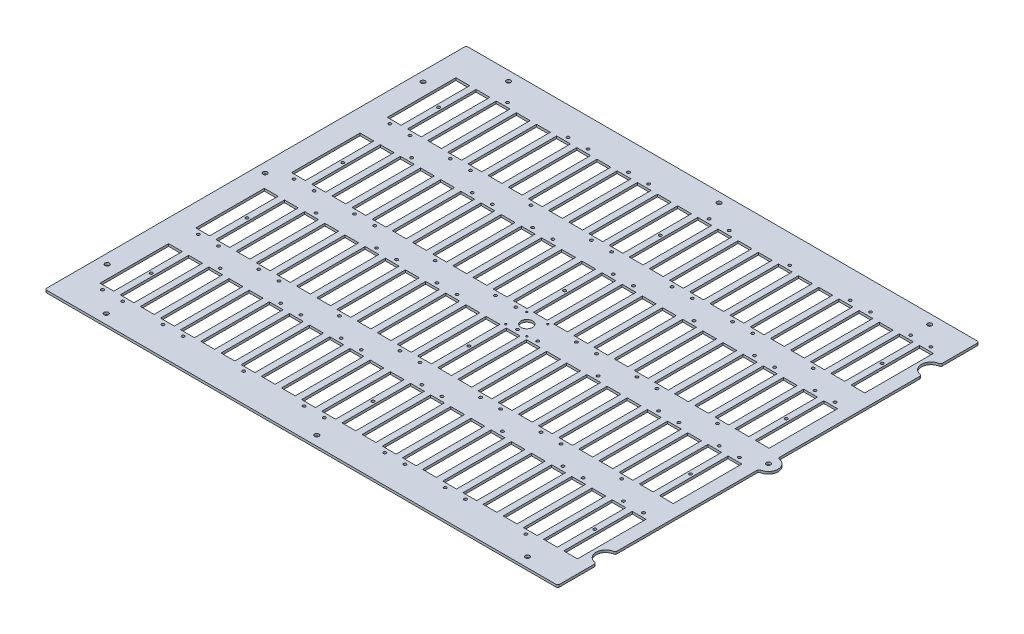
from build123d import *

# Parameters (mm, degrees)
BOSS_EXTRUDE1_DEPTH          = 3.175
SKETCH17_W                   = 18.288
SKETCH17_H                   = 90.932
CUT_EXTRUDE5_DEPTH           = 451.265762746
F_25_0_1495_DIAMETER_HOLE1_D = 3.7973
FILLET1_R                    = 2.54
F_6_CLEARANCE_HOLE1_D        = 3.7973
F_2_CLEARANCE_HOLE1_D        = 2.4384
SKETCH20_R                   = 7.62
CUT_EXTRUDE6_DEPTH           = 451.265762746
F_1_0_228_DIAMETER_HOLE1_D   = 5.7912


with BuildPart() as part:
    # Sketch1 → Boss-Extrude1 (new body)
    with BuildSketch(Plane(origin=(0, 0, 0), x_dir=(1, 0, 0), z_dir=(0, 1, 0))):
        with BuildLine():
            Line((340.2584, 228.6), (340.2584, 279.5524))
            Line((340.2584, 279.5524), (-340.2584, 279.5524))
            Line((-340.2584, 279.5524), (-340.2584, -279.5524))
            Line((-340.2584, -279.5524), (340.2584, -279.5524))
            Line((340.2584, -279.5524), (340.2584, -228.6))
            ThreePointArc((340.2584, -228.6), (327.5584, -215.9), (340.2584, -203.2))
            Line((340.2584, -203.2), (340.2584, -12.7))
            ThreePointArc((340.2584, -12.7), (352.9584, 0), (340.2584, 12.7))
            Line((340.2584, 12.7), (340.2584, 203.2))
            ThreePointArc((340.2584, 203.2), (327.5584, 215.9), (340.2584, 228.6))
        make_face()
    extrude(amount=BOSS_EXTRUDE1_DEPTH)

    # Sketch17 → Cut-Extrude5 (cut, through all)
    with BuildSketch(Plane(origin=(0, 3.175, 0), x_dir=(1, 0, 0), z_dir=(0, 1, 0))):
        with Locations((-274.696582609, 190.6524)):
            Rectangle(SKETCH17_W, SKETCH17_H)
        with Locations((-301.4472, 190.6524)):
            Rectangle(SKETCH17_W, SKETCH17_H)
        with Locations((-247.945965217, 190.6524)):
            Rectangle(SKETCH17_W, SKETCH17_H)
        with Locations((-221.195347826, 190.6524)):
            Rectangle(SKETCH17_W, SKETCH17_H)
        with Locations((-194.444730435, 190.6524)):
            Rectangle(SKETCH17_W, SKETCH17_H)
        with Locations((-167.694113043, 190.6524)):
            Rectangle(SKETCH17_W, SKETCH17_H)
        with Locations((-140.943495652, 190.6524)):
            Rectangle(SKETCH17_W, SKETCH17_H)
        with Locations((-114.192878261, 190.6524)):
            Rectangle(SKETCH17_W, SKETCH17_H)
        with Locations((-87.44226087, 190.6524)):
            Rectangle(SKETCH17_W, SKETCH17_H)
        with Locations((-60.691643478, 190.6524)):
            Rectangle(SKETCH17_W, SKETCH17_H)
        with Locations((-33.941026087, 190.6524)):
            Rectangle(SKETCH17_W, SKETCH17_H)
        with Locations((-7.190408696, 190.6524)):
            Rectangle(SKETCH17_W, SKETCH17_H)
        with Locations((19.560208696, 190.6524)):
            Rectangle(SKETCH17_W, SKETCH17_H)
        with Locations((46.310826087, 190.6524)):
            Rectangle(SKETCH17_W, SKETCH17_H)
        with Locations((73.061443478, 190.6524)):
            Rectangle(SKETCH17_W, SKETCH17_H)
        with Locations((99.81206087, 190.6524)):
            Rectangle(SKETCH17_W, SKETCH17_H)
        with Locations((126.562678261, 190.6524)):
            Rectangle(SKETCH17_W, SKETCH17_H)
        with Locations((153.313295652, 190.6524)):
            Rectangle(SKETCH17_W, SKETCH17_H)
        with Locations((180.063913043, 190.6524)):
            Rectangle(SKETCH17_W, SKETCH17_H)
        with Locations((206.814530435, 190.6524)):
            Rectangle(SKETCH17_W, SKETCH17_H)
        with Locations((233.565147826, 190.6524)):
            Rectangle(SKETCH17_W, SKETCH17_H)
        with Locations((260.315765217, 190.6524)):
            Rectangle(SKETCH17_W, SKETCH17_H)
        with Locations((287.066382609, 190.6524)):
            Rectangle(SKETCH17_W, SKETCH17_H)
        with Locations((313.817, 190.6524)):
            Rectangle(SKETCH17_W, SKETCH17_H)
        with Locations((-274.696582609, 63.5762)):
            Rectangle(SKETCH17_W, SKETCH17_H)
        with Locations((-247.945965217, 63.5762)):
            Rectangle(SKETCH17_W, SKETCH17_H)
        with Locations((-221.195347826, 63.5762)):
            Rectangle(SKETCH17_W, SKETCH17_H)
        with Locations((-194.444730435, 63.5762)):
            Rectangle(SKETCH17_W, SKETCH17_H)
        with Locations((-167.694113043, 63.5762)):
            Rectangle(SKETCH17_W, SKETCH17_H)
        with Locations((-140.943495652, 63.5762)):
            Rectangle(SKETCH17_W, SKETCH17_H)
        with Locations((-114.192878261, 63.5762)):
            Rectangle(SKETCH17_W, SKETCH17_H)
        with Locations((-87.44226087, 63.5762)):
            Rectangle(SKETCH17_W, SKETCH17_H)
        with Locations((-60.691643478, 63.5762)):
            Rectangle(SKETCH17_W, SKETCH17_H)
        with Locations((-33.941026087, 63.5762)):
            Rectangle(SKETCH17_W, SKETCH17_H)
        with Locations((-7.190408696, 63.5762)):
            Rectangle(SKETCH17_W, SKETCH17_H)
        with Locations((19.560208696, 63.5762)):
            Rectangle(SKETCH17_W, SKETCH17_H)
        with Locations((46.310826087, 63.5762)):
            Rectangle(SKETCH17_W, SKETCH17_H)
        with Locations((73.061443478, 63.5762)):
            Rectangle(SKETCH17_W, SKETCH17_H)
        with Locations((99.81206087, 63.5762)):
            Rectangle(SKETCH17_W, SKETCH17_H)
        with Locations((126.562678261, 63.5762)):
            Rectangle(SKETCH17_W, SKETCH17_H)
        with Locations((153.313295652, 63.5762)):
            Rectangle(SKETCH17_W, SKETCH17_H)
        with Locations((180.063913043, 63.5762)):
            Rectangle(SKETCH17_W, SKETCH17_H)
        with Locations((206.814530435, 63.5762)):
            Rectangle(SKETCH17_W, SKETCH17_H)
        with Locations((233.565147826, 63.5762)):
            Rectangle(SKETCH17_W, SKETCH17_H)
        with Locations((260.315765217, 63.5762)):
            Rectangle(SKETCH17_W, SKETCH17_H)
        with Locations((287.066382609, 63.5762)):
            Rectangle(SKETCH17_W, SKETCH17_H)
        with Locations((313.817, 63.5762)):
            Rectangle(SKETCH17_W, SKETCH17_H)
        with Locations((-274.696582609, -63.5)):
            Rectangle(SKETCH17_W, SKETCH17_H)
        with Locations((-247.945965217, -63.5)):
            Rectangle(SKETCH17_W, SKETCH17_H)
        with Locations((-221.195347826, -63.5)):
            Rectangle(SKETCH17_W, SKETCH17_H)
        with Locations((-194.444730435, -63.5)):
            Rectangle(SKETCH17_W, SKETCH17_H)
        with Locations((-167.694113043, -63.5)):
            Rectangle(SKETCH17_W, SKETCH17_H)
        with Locations((-140.943495652, -63.5)):
            Rectangle(SKETCH17_W, SKETCH17_H)
        with Locations((-114.192878261, -63.5)):
            Rectangle(SKETCH17_W, SKETCH17_H)
        with Locations((-87.44226087, -63.5)):
            Rectangle(SKETCH17_W, SKETCH17_H)
        with Locations((-60.691643478, -63.5)):
            Rectangle(SKETCH17_W, SKETCH17_H)
        with Locations((-33.941026087, -63.5)):
            Rectangle(SKETCH17_W, SKETCH17_H)
        with Locations((-7.190408696, -63.5)):
            Rectangle(SKETCH17_W, SKETCH17_H)
        with Locations((19.560208696, -63.5)):
            Rectangle(SKETCH17_W, SKETCH17_H)
        with Locations((46.310826087, -63.5)):
            Rectangle(SKETCH17_W, SKETCH17_H)
        with Locations((73.061443478, -63.5)):
            Rectangle(SKETCH17_W, SKETCH17_H)
        with Locations((99.81206087, -63.5)):
            Rectangle(SKETCH17_W, SKETCH17_H)
        with Locations((126.562678261, -63.5)):
            Rectangle(SKETCH17_W, SKETCH17_H)
        with Locations((153.313295652, -63.5)):
            Rectangle(SKETCH17_W, SKETCH17_H)
        with Locations((180.063913043, -63.5)):
            Rectangle(SKETCH17_W, SKETCH17_H)
        with Locations((206.814530435, -63.5)):
            Rectangle(SKETCH17_W, SKETCH17_H)
        with Locations((233.565147826, -63.5)):
            Rectangle(SKETCH17_W, SKETCH17_H)
        with Locations((260.315765217, -63.5)):
            Rectangle(SKETCH17_W, SKETCH17_H)
        with Locations((287.066382609, -63.5)):
            Rectangle(SKETCH17_W, SKETCH17_H)
        with Locations((313.817, -63.5)):
            Rectangle(SKETCH17_W, SKETCH17_H)
        with Locations((-274.696582609, -190.5762)):
            Rectangle(SKETCH17_W, SKETCH17_H)
        with Locations((-247.945965217, -190.5762)):
            Rectangle(SKETCH17_W, SKETCH17_H)
        with Locations((-221.195347826, -190.5762)):
            Rectangle(SKETCH17_W, SKETCH17_H)
        with Locations((-194.444730435, -190.5762)):
            Rectangle(SKETCH17_W, SKETCH17_H)
        with Locations((-167.694113043, -190.5762)):
            Rectangle(SKETCH17_W, SKETCH17_H)
        with Locations((-140.943495652, -190.5762)):
            Rectangle(SKETCH17_W, SKETCH17_H)
        with Locations((-114.192878261, -190.5762)):
            Rectangle(SKETCH17_W, SKETCH17_H)
        with Locations((-87.44226087, -190.5762)):
            Rectangle(SKETCH17_W, SKETCH17_H)
        with Locations((-60.691643478, -190.5762)):
            Rectangle(SKETCH17_W, SKETCH17_H)
        with Locations((-33.941026087, -190.5762)):
            Rectangle(SKETCH17_W, SKETCH17_H)
        with Locations((-7.190408696, -190.5762)):
            Rectangle(SKETCH17_W, SKETCH17_H)
        with Locations((19.560208696, -190.5762)):
            Rectangle(SKETCH17_W, SKETCH17_H)
        with Locations((46.310826087, -190.5762)):
            Rectangle(SKETCH17_W, SKETCH17_H)
        with Locations((73.061443478, -190.5762)):
            Rectangle(SKETCH17_W, SKETCH17_H)
        with Locations((99.81206087, -190.5762)):
            Rectangle(SKETCH17_W, SKETCH17_H)
        with Locations((126.562678261, -190.5762)):
            Rectangle(SKETCH17_W, SKETCH17_H)
        with Locations((153.313295652, -190.5762)):
            Rectangle(SKETCH17_W, SKETCH17_H)
        with Locations((180.063913043, -190.5762)):
            Rectangle(SKETCH17_W, SKETCH17_H)
        with Locations((206.814530435, -190.5762)):
            Rectangle(SKETCH17_W, SKETCH17_H)
        with Locations((233.565147826, -190.5762)):
            Rectangle(SKETCH17_W, SKETCH17_H)
        with Locations((260.315765217, -190.5762)):
            Rectangle(SKETCH17_W, SKETCH17_H)
        with Locations((287.066382609, -190.5762)):
            Rectangle(SKETCH17_W, SKETCH17_H)
        with Locations((313.817, -190.5762)):
            Rectangle(SKETCH17_W, SKETCH17_H)
        with Locations((-301.4472, 63.5762)):
            Rectangle(SKETCH17_W, SKETCH17_H)
        with Locations((-301.4472, -63.5)):
            Rectangle(SKETCH17_W, SKETCH17_H)
        with Locations((-301.4472, -190.5762)):
            Rectangle(SKETCH17_W, SKETCH17_H)
    extrude(amount=-CUT_EXTRUDE5_DEPTH, mode=Mode.SUBTRACT)

    # #25 (0.1495) Diameter Hole1 (through all)
    with Locations(Plane(origin=(0, 3.175, 0), x_dir=(1, 0, 0), z_dir=(0, 1, 0))):
        with Locations((-301.447198222, 139.3444), (313.817, -139.2682), (287.066382686, -139.2682), (260.315765372, -241.8842), (233.565148058, -139.2682), (206.814530744, -139.2682), (180.06391343, -241.8842), (153.313296116, -241.8842), (126.562678802, -139.2682), (99.812061488, -241.8842), (73.061444174, -241.8842), (46.31082686, -139.2682), (19.560209546, -139.2682), (-7.190407768, -241.8842), (-33.941025082, -241.8842), (-60.691642396, -139.2682), (-87.44225971, -139.2682), (-114.192877024, -241.8842), (-140.943494338, -139.2682), (-167.694111652, -139.2682), (-194.444728966, -241.8842), (-221.19534628, -241.8842), (-247.945963594, -139.2682), (-274.696580908, -241.8842), (-301.447198222, -241.8842), (313.817, -12.192), (287.066382686, -12.192), (260.315765372, -114.808), (233.565148058, -12.192), (206.814530744, -12.192), (180.06391343, -114.808), (153.313296116, -114.808), (126.562678802, -12.192), (99.812061488, -114.808), (73.061444174, -114.808), (46.31082686, -12.192), (19.560209546, -12.192), (-7.190407768, -114.808), (-33.941025082, -114.808), (-60.691642396, -12.192), (-87.44225971, -12.192), (-114.192877024, -114.808), (-140.943494338, -12.192), (-167.694111652, -12.192), (-194.444728966, -114.808), (-221.19534628, -114.808), (-247.945963594, -12.192), (-274.696580908, -114.808), (-301.447198222, -114.808), (313.817, 114.8842), (287.066382686, 114.8842), (260.315765372, 12.2682), (233.565148058, 114.8842), (206.814530744, 114.8842), (180.06391343, 12.2682), (153.313296116, 12.2682), (126.562678802, 114.8842), (99.812061488, 12.2682), (73.061444174, 12.2682), (46.31082686, 114.8842), (19.560209546, 114.8842), (-7.190407768, 12.2682), (-33.941025082, 12.2682), (-60.691642396, 114.8842), (-87.44225971, 114.8842), (-114.192877024, 12.2682), (-140.943494338, 114.8842), (-167.694111652, 114.8842), (-194.444728966, 12.2682), (-221.19534628, 12.2682), (-247.945963594, 114.8842), (-274.696580908, 12.2682), (-301.447198222, 12.2682), (313.817, 241.9604), (287.066382686, 241.9604), (260.315765372, 139.3444), (233.565148058, 241.9604), (206.814530744, 241.9604), (180.06391343, 139.3444), (153.313296116, 139.3444), (126.562678802, 241.9604), (99.812061488, 139.3444), (73.061444174, 139.3444), (46.31082686, 241.9604), (19.560209546, 241.9604), (-7.190407768, 139.3444), (-33.941025082, 139.3444), (-60.691642396, 241.9604), (-87.44225971, 241.9604), (-114.192877024, 139.3444), (-140.943494338, 241.9604), (-167.694111652, 241.9604), (-194.444728966, 139.3444), (-221.19534628, 139.3444), (-247.945963594, 241.9604), (-274.696580908, 139.3444)):
            Hole(F_25_0_1495_DIAMETER_HOLE1_D / 2)

    # Fillet1
    fillet1_edges = [part.edges().sort_by_distance(p)[0] for p in [
        (-340.2584, 1.5875, -279.5524),
        (-340.2584, 1.5875, 279.5524),
        (340.2584, 1.5875, 279.5524),
        (340.2584, 1.5875, 228.6),
        (340.2584, 1.5875, 203.2),
        (340.2584, 1.5875, 12.7),
        (340.2584, 1.5875, -12.7),
        (340.2584, 1.5875, -203.2),
        (340.2584, 1.5875, -279.5524),
        (340.2584, 1.5875, -228.6),
    ]]
    fillet(fillet1_edges, radius=FILLET1_R)

    # #6 Clearance Hole1 (through all)
    with Locations(Plane(origin=(0, 3.175, 0), x_dir=(1, 0, 0), z_dir=(0, 1, 0))):
        with Locations((300.441691304, -190.5762), (-288.071891304, 190.6524), (6.1849, 190.6524), (300.441691304, 190.6524), (-288.071891304, 63.5762), (6.1849, 63.5762), (300.441691304, 63.5762), (-288.071891304, -63.5), (6.1849, -63.5), (300.441691304, -63.5), (-288.071891304, -190.5762), (6.1849, -190.5762)):
            Hole(F_6_CLEARANCE_HOLE1_D / 2)

    # #2 Clearance Hole1 (through all)
    with Locations(Plane(origin=(0, 3.175, 0), x_dir=(1, 0, 0), z_dir=(0, 1, 0))):
        with Locations((33.5661, 14.0081), (5.6261, 14.0081), (5.6261, -13.9319), (33.5661, -13.9319)):
            Hole(F_2_CLEARANCE_HOLE1_D / 2)

    # Sketch20 → Cut-Extrude6 (cut, through all)
    with BuildSketch(Plane(origin=(0, 3.175, 0), x_dir=(1, 0, 0), z_dir=(0, 1, 0))):
        with Locations((19.5961, 0.0381)):
            Circle(SKETCH20_R)
    extrude(amount=-CUT_EXTRUDE6_DEPTH, mode=Mode.SUBTRACT)

    # #1 (0.228) Diameter Hole1 (through all)
    with Locations(Plane(origin=(0, 3.175, 0), x_dir=(1, 0, 0), z_dir=(0, 1, 0))):
        with Locations((287.274, -266.8524), (287.274, 266.8524), (7.874, 266.8524), (-271.526, 266.8524), (-327.5584, 209.55), (-327.5584, 0), (-327.5584, -209.55), (-271.526, -266.8524), (7.874, -266.8524), (340.2584, 0)):
            Hole(F_1_0_228_DIAMETER_HOLE1_D / 2)


solid = part.part
